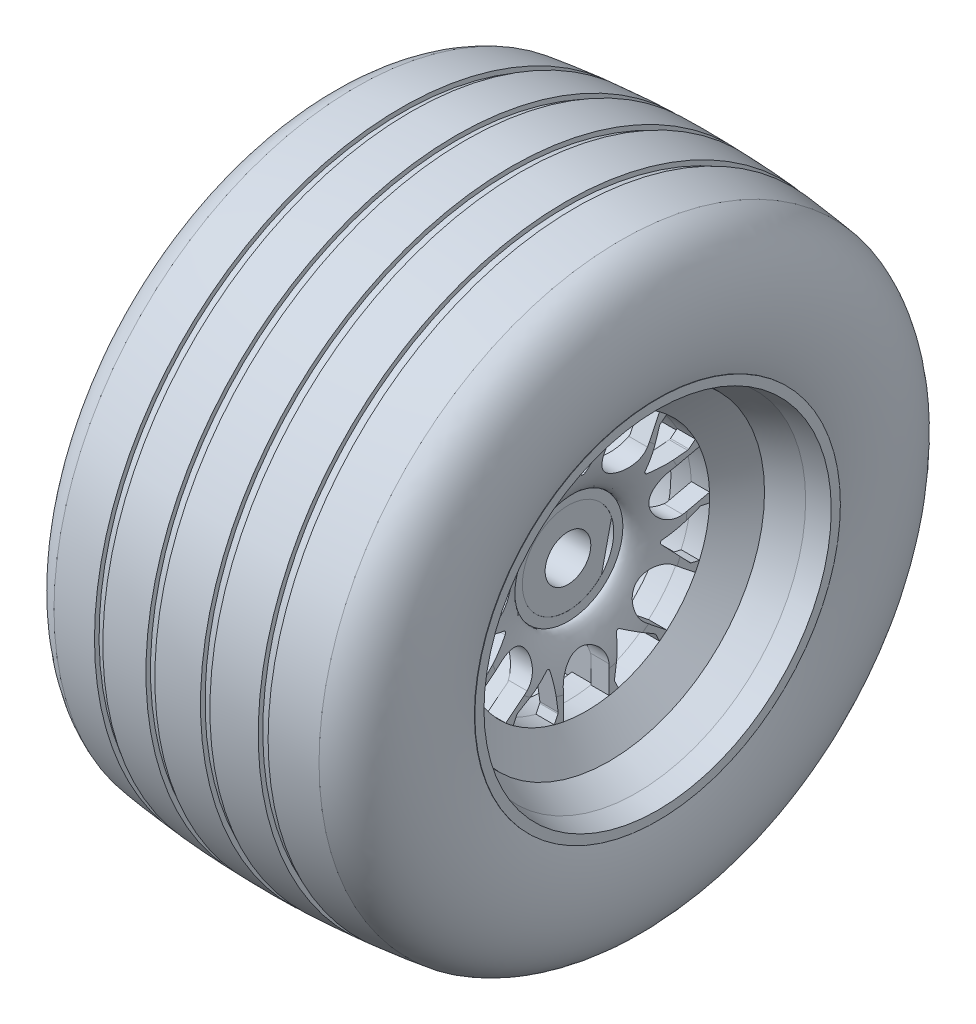
from build123d import *

# Parameters (mm, degrees)
BOSS_EXTRU_2_DEPTH      = 2.3
BOSS_EXTRU_2_DEPTH_BACK = 34.75
ESQUISSE4_R             = 20
ESQUISSE4_R_2           = 18.5
BOSS_EXTRU_3_DEPTH      = 3
BOSS_EXTRU_3_DEPTH_BACK = 31.75
ESQUISSE5_R             = 18.5
ESQUISSE5_R_2           = 17
CHANFREIN1_SIZE         = 1.5
CHANFREIN1_SIZE_2       = 3.5
ESQUISSE7_R             = 17
ESQUISSE7_R_2           = 13.5
BOSS_EXTRU_4_DEPTH      = 31.75
CHANFREIN2_SIZE         = 3.5
CHANFREIN2_SIZE_2       = 2.5
BOSS_EXTRU_5_START      = -2.5
BOSS_EXTRU_5_OUTLINE_R  = 6
BOSS_EXTRU_5_DEPTH      = 29.25
CONG_1_SIZE             = 2
CONG_1_SIZE_2           = 5
ESQUISSE10_R            = 6
ESQUISSE10_R_2          = 5
BOSS_EXTRU_6_DEPTH      = 27.25
ESQUISSE11_R            = 5
ESQUISSE11_R_2          = 2.5
BOSS_EXTRU_7_DEPTH      = 25
ENL_V_START             = -25
ESQUISSE13_R            = 16.006499161
ESQUISSE13_R_2          = 13.506499161
ENL_V_MAT_EXTRU_1_DEPTH = 25
ESQUISSE14_R            = 6
ESQUISSE14_R_2          = 4.5
BOSS_EXTRU_8_DEPTH      = 20
ESQUISSE15_R            = 4.5
ESQUISSE15_R_2          = 2.5
BOSS_EXTRU_9_DEPTH      = 20
BOSS_EXTRU_10_REACH     = 73.556
CHANFREIN3_SIZE         = 1
CHANFREIN3_SIZE2        = 4
ESQUISSE17_R            = 2.5
ENL_V_MAT_EXTRU_2_DEPTH = 4
ESQUISSE18_R            = 2.5
BOSS_EXTRU_21_DEPTH     = 3.99
ENL_V_MAT_EXTRU_3_DEPTH = 20
CHANFREIN4_SIZE2        = 0.5
CHANFREIN4_SIZE         = 2.3


with BuildPart() as part:
    # Esquisse1 → Révolution1 (revolve)
    with BuildSketch(Plane.XY, mode=Mode.PRIVATE) as r_volution1_sk:
        with BuildLine():
            Line((-18.5, 0), (18.5, 0))
            add(Edge.make_bspline(
                [(18.5, 0), (19.838405168, 4.08979284), (19.267998375, 11.346275547), (14.5, 13)],
                knots=[0, 0, 0, 0, 1, 1, 1, 1], degree=3))
            add(Edge.make_bspline(
                [(-14.5, 13), (0, 15), (14.5, 13)],
                knots=[0, 0, 0, 1, 1, 1], degree=2))
            add(Edge.make_bspline(
                [(-18.5, 0), (-19.838405168, 4.08979284), (-19.267998375, 11.346275547), (-14.5, 13)],
                knots=[0, 0, 0, 0, 1, 1, 1, 1], degree=3))
        make_face()
        with BuildLine():
            Line((-18.130534342, 0.5), (18.130534342, 0.5))
            add(Edge.make_bspline(
                [(14.381712775, 12.511569715), (14.636876339, 12.420414194), (15.139350664, 12.193822903), (16.013753743, 11.61482082), (17.295334454, 10.272133606), (18.202730118, 8.115054823), (18.598514858, 5.693803273), (18.657759464, 3.84596138), (18.52882494, 2.365757753), (18.328627834, 1.257355727), (18.203635594, 0.754257622), (18.130534342, 0.5)],
                knots=[0.028863626, 0.028863626, 0.028863626, 0.028863626, 0.089340842, 0.149818057, 0.270772488, 0.51268135, 0.633635781, 0.754590211, 0.875544642, 0.936021858, 0.996499073, 0.996499073, 0.996499073, 0.996499073], degree=3))
            add(Edge.make_bspline(
                [(-14.381712775, 12.511569715), (-4.883214165, 13.817171608), (4.883214165, 13.817171608), (14.381712775, 12.511569715)],
                knots=[0.001731057, 0.001731057, 0.001731057, 0.001731057, 0.998268943, 0.998268943, 0.998268943, 0.998268943], degree=3))
            add(Edge.make_bspline(
                [(-18.130534342, 0.5), (-18.203635594, 0.754257622), (-18.328627834, 1.257355727), (-18.52882494, 2.365757753), (-18.657759464, 3.84596138), (-18.598514858, 5.693803273), (-18.202730118, 8.115054823), (-17.295334454, 10.272133606), (-16.013753743, 11.61482082), (-15.139350664, 12.193822903), (-14.636876339, 12.420414194), (-14.381712775, 12.511569715)],
                knots=[0.028863626, 0.028863626, 0.028863626, 0.028863626, 0.089340842, 0.149818057, 0.270772488, 0.391726919, 0.51268135, 0.754590211, 0.875544642, 0.936021858, 0.996499073, 0.996499073, 0.996499073, 0.996499073], degree=3))
        make_face(mode=Mode.SUBTRACT)
        with BuildLine():
            add(Edge.make_bspline(
                [(-18.130534342, 0.5), (-18.203635594, 0.754257622), (-18.328627834, 1.257355727), (-18.52882494, 2.365757753), (-18.657759464, 3.84596138), (-18.598514858, 5.693803273), (-18.202730118, 8.115054823), (-17.295334454, 10.272133606), (-16.013753743, 11.61482082), (-15.139350664, 12.193822903), (-14.636876339, 12.420414194), (-14.381712775, 12.511569715)],
                knots=[0.028863626, 0.028863626, 0.028863626, 0.028863626, 0.089340842, 0.149818057, 0.270772488, 0.391726919, 0.51268135, 0.754590211, 0.875544642, 0.936021858, 0.996499073, 0.996499073, 0.996499073, 0.996499073], degree=3))
            add(Edge.make_bspline(
                [(-14.381712775, 12.511569715), (-4.883214165, 13.817171608), (4.883214165, 13.817171608), (14.381712775, 12.511569715)],
                knots=[0.001731057, 0.001731057, 0.001731057, 0.001731057, 0.998268943, 0.998268943, 0.998268943, 0.998268943], degree=3))
            add(Edge.make_bspline(
                [(14.381712775, 12.511569715), (14.636876339, 12.420414194), (15.139350664, 12.193822903), (16.013753743, 11.61482082), (17.295334454, 10.272133606), (18.202730118, 8.115054823), (18.598514858, 5.693803273), (18.657759464, 3.84596138), (18.52882494, 2.365757753), (18.328627834, 1.257355727), (18.203635594, 0.754257622), (18.130534342, 0.5)],
                knots=[0.028863626, 0.028863626, 0.028863626, 0.028863626, 0.089340842, 0.149818057, 0.270772488, 0.51268135, 0.633635781, 0.754590211, 0.875544642, 0.936021858, 0.996499073, 0.996499073, 0.996499073, 0.996499073], degree=3))
            Line((18.130534342, 0.5), (-18.130534342, 0.5))
        make_face()
    revolve(r_volution1_sk.sketch.rotate(Axis((-14.222170654, -20, 0), (1, 0, 0)), 90), axis=Axis((-14.222170654, -20, 0), (1, 0, 0)))

    # Esquisse2 → Enlèvement de matière-Révolution1 (revolve, cut)
    with BuildSketch(Plane.XY, mode=Mode.PRIVATE) as enl_vement_de_mati_re_r_volution1_sk:
        with BuildLine():
            add(Edge.make_bspline(
                [(9.5, 13.570749108), (9.469046555, 13.573546328), (9.354445173, 13.583852082), (9.156185559, 13.601356777), (8.905208522, 13.622916802), (8.686479763, 13.641184362), (8.551405375, 13.652205035), (8.5, 13.656361474)],
                knots=[0.173002382, 0.173002382, 0.173002382, 0.173002382, 0.176207377, 0.184868019, 0.193526873, 0.202183989, 0.207502326, 0.207502326, 0.207502326, 0.207502326], degree=3))
            Line((8.5, 13.656361474), (8.5, 13.152836254))
            add(Edge.make_bspline(
                [(9.499713629, 13.066831574), (9.166627198, 13.097058306), (8.833383724, 13.125729227), (8.5, 13.152836254)],
                knots=[0.171528386, 0.171528386, 0.171528386, 0.171528386, 0.206183616, 0.206183616, 0.206183616, 0.206183616], degree=3))
            Line((9.499713629, 13.066831574), (9.5, 13.068701961))
            Line((9.5, 13.068701961), (9.5, 13.570749108))
        make_face()
        with BuildLine():
            add(Edge.make_bspline(
                [(3.5, 13.941736029), (3.470411898, 13.942721126), (3.35866268, 13.946394493), (3.163071873, 13.952511989), (2.913223052, 13.959734696), (2.69164005, 13.965610118), (2.55389754, 13.968991735), (2.5, 13.970273484)],
                knots=[0.379668525, 0.379668525, 0.379668525, 0.379668525, 0.382721406, 0.391198576, 0.399848132, 0.408497116, 0.414056722, 0.414056722, 0.414056722, 0.414056722], degree=3))
            Line((2.5, 13.970273484), (2.5, 13.469815753))
            add(Edge.make_bspline(
                [(3.499393313, 13.440849741), (3.166312677, 13.452099691), (2.833176039, 13.461757692), (2.5, 13.469815753)],
                knots=[0.379163728, 0.379163728, 0.379163728, 0.379163728, 0.413685793, 0.413685793, 0.413685793, 0.413685793], degree=3))
            Line((3.499393313, 13.440849741), (3.5, 13.441457665))
            Line((3.5, 13.441457665), (3.5, 13.941736029))
        make_face()
        with BuildLine():
            add(Edge.make_bspline(
                [(-2.5, 13.970273484), (-2.581304098, 13.968339974), (-2.74626995, 13.964225502), (-2.993396157, 13.957480158), (-3.241385209, 13.950124496), (-3.40975236, 13.944735733), (-3.495956983, 13.941870636), (-3.5, 13.941736029)],
                knots=[0.585943286, 0.585943286, 0.585943286, 0.585943286, 0.594329916, 0.60296021, 0.611436962, 0.619914327, 0.620331483, 0.620331483, 0.620331483, 0.620331483], degree=3))
            Line((-3.5, 13.941736029), (-3.5, 13.441457665))
            add(Edge.make_bspline(
                [(-2.5, 13.470131442), (-2.583343957, 13.468139952), (-2.750025673, 13.463958856), (-3.000036551, 13.457087793), (-3.250029044, 13.449620765), (-3.416678536, 13.444244994), (-3.5, 13.441457665)],
                knots=[0.586353967, 0.586353967, 0.586353967, 0.586353967, 0.594992084, 0.603630201, 0.612268318, 0.620906435, 0.620906435, 0.620906435, 0.620906435], degree=3))
            Line((-2.5, 13.470131442), (-2.5, 13.970273484))
        make_face()
        with BuildLine():
            add(Edge.make_bspline(
                [(-8.5, 13.656361474), (-8.536308973, 13.653425672), (-8.664856178, 13.642965242), (-8.877243674, 13.625292802), (-9.137151077, 13.603013358), (-9.341939611, 13.584968758), (-9.462885168, 13.574103124), (-9.5, 13.570749108)],
                knots=[0.79249768, 0.79249768, 0.79249768, 0.79249768, 0.796254161, 0.805797567, 0.81447522, 0.823154663, 0.826997623, 0.826997623, 0.826997623, 0.826997623], degree=3))
            Line((-9.5, 13.570749108), (-9.5, 13.068701961))
            add(Edge.make_bspline(
                [(-8.5, 13.154721949), (-8.583366254, 13.14794917), (-8.750082899, 13.134205585), (-9.000108949, 13.112996811), (-9.250087352, 13.091192573), (-9.416700791, 13.076265421), (-9.5, 13.068701961)],
                knots=[0.793893955, 0.793893955, 0.793893955, 0.793893955, 0.802560004, 0.811226054, 0.819892104, 0.828558153, 0.828558153, 0.828558153, 0.828558153], degree=3))
            Line((-8.5, 13.154721949), (-8.5, 13.656361474))
        make_face()
    revolve(enl_vement_de_mati_re_r_volution1_sk.sketch.rotate(Axis((-16.70272556, -20, 0), (1, 0, 0)), 180), axis=Axis((-16.70272556, -20, 0), (1, 0, 0)), mode=Mode.SUBTRACT)

    # Esquisse4 → Boss.-Extru.2 (add, two sides: drawn at the far end of the back side and taken through both)
    with BuildSketch(Plane(origin=(16.25, 0, 0), x_dir=(0, 0, -1), z_dir=(1, 0, 0)).offset(-BOSS_EXTRU_2_DEPTH_BACK)):
        with Locations(Location((0, -20, 0), (0, 0, 180))):
            Circle(ESQUISSE4_R)
        with Locations((0, -20)):
            Circle(ESQUISSE4_R_2, mode=Mode.SUBTRACT)
    extrude(amount=BOSS_EXTRU_2_DEPTH + BOSS_EXTRU_2_DEPTH_BACK)



with BuildPart() as body_2:
    # Esquisse5 → Boss.-Extru.3 (new, two sides: drawn at the far end of the back side and taken through both)
    with BuildSketch(Plane(origin=(13.25, 0, 0), x_dir=(0, 0, -1), z_dir=(1, 0, 0)).offset(-BOSS_EXTRU_3_DEPTH_BACK)):
        with Locations((0, -20)):
            Circle(ESQUISSE5_R)
        with Locations((0, -20)):
            Circle(ESQUISSE5_R_2, mode=Mode.SUBTRACT)
    extrude(amount=BOSS_EXTRU_3_DEPTH + BOSS_EXTRU_3_DEPTH_BACK)

    # Chanfrein1
    # the kernel refuses this chamfer: 3.5, 1.5 mm, written as the material it takes off along each edge
    with BuildSketch(Plane(origin=(16.25, -20, 0), x_dir=(0, 0, -1), z_dir=(0, -1, 0))) as chanfrein1_piece_1:
        Polygon((17 + CHANFREIN1_SIZE, 0), (17, -CHANFREIN1_SIZE_2), (17, 0), align=None)
    revolve(axis=Axis((16.25, -20, 0), (1, 0, 0)), mode=Mode.SUBTRACT)


with BuildPart() as part_1:
    add(part.part)

    add(body_2.part)  # Boss.-Extru.4 merges body 2
    # Esquisse7 → Boss.-Extru.4 (add)
    with BuildSketch(Plane(origin=(13.25, 0, 0), x_dir=(0, 0, -1), z_dir=(1, 0, 0))):
        with Locations((0, -20)):
            Circle(ESQUISSE7_R)
        with Locations((0, -20)):
            Circle(ESQUISSE7_R_2, mode=Mode.SUBTRACT)
    extrude(amount=-BOSS_EXTRU_4_DEPTH)

    # Chanfrein2
    # the kernel refuses this chamfer: 3.5, 2.5 mm, written as the material it takes off along each edge
    with BuildSketch(Plane(origin=(13.25, -20, 0), x_dir=(0, 0, -1), z_dir=(0, -1, 0))) as chanfrein2_piece_1:
        Polygon((13.5 + CHANFREIN2_SIZE, 0), (13.5, -CHANFREIN2_SIZE_2), (13.5, 0), align=None)
    revolve(axis=Axis((13.25, -20, 0), (1, 0, 0)), mode=Mode.SUBTRACT)



with BuildPart() as body_2_2:
    # Boss.-Extru.5: read off the stored shape, not the designer's step
    # Boss.-Extru.5 outline → Boss.-Extru.5 (new body)
    with BuildSketch(Plane.ZY.offset(-8.25).offset(BOSS_EXTRU_5_START)):
        with BuildLine():
            Line((-3.503696091, -6.962587922), (-2.202044874, -9.665494525))
            ThreePointArc((-2.202044874, -9.665494525), (-3.369757696, -13.002626043), (-6.706889214, -11.834913221))
            Line((-6.706889214, -11.834913221), (-8.008540431, -9.132006617))
            ThreePointArc((-8.008540431, -9.132006617), (-8.417112325, -9.445274987), (-8.813442202, -9.77389436))
            Line((-8.813442202, -9.77389436), (-8.090574677, -10.350361975))
            ThreePointArc((-8.090574677, -10.350361975), (-8.040766001, -10.403709768), (-8.008487581, -10.46916964))
            Line((-8.008487581, -10.46916964), (-6.761048774, -14.34182691))
            ThreePointArc((-6.761048774, -14.34182691), (-6.803550451, -14.574349566), (-7.020785765, -14.667526795))
            Line((-7.020785765, -14.667526795), (-11.07392868, -14.313111196))
            ThreePointArc((-11.07392868, -14.313111196), (-11.144929961, -14.296208255), (-11.208023687, -14.259519387))
            Line((-11.208023687, -14.259519387), (-11.930891211, -13.683051773))
            ThreePointArc((-11.930891211, -13.683051773), (-12.163079717, -14.142569522), (-12.377577995, -14.610606436))
            Line((-12.377577995, -14.610606436), (-9.452794258, -15.278169238))
            ThreePointArc((-9.452794258, -15.278169238), (-7.571776812, -18.271791354), (-10.565398928, -20.152808799))
            Line((-10.565398928, -20.152808799), (-13.490182664, -19.485245997))
            ThreePointArc((-13.490182664, -19.485245997), (-13.5, -20), (-13.490182664, -20.514754003))
            Line((-13.490182664, -20.514754003), (-12.588781605, -20.309015094))
            ThreePointArc((-12.588781605, -20.309015094), (-12.516017419, -20.303334907), (-12.444713564, -20.318912185))
            Line((-12.444713564, -20.318912185), (-8.639182815, -21.758187567))
            ThreePointArc((-8.639182815, -21.758187567), (-8.483888645, -21.936392221), (-8.546483757, -22.164328681))
            Line((-8.546483757, -22.164328681), (-11.350670302, -25.112228903))
            ThreePointArc((-11.350670302, -25.112228903), (-11.408154128, -25.157201128), (-11.476176935, -25.183654655))
            Line((-11.476176935, -25.183654655), (-12.377577995, -25.389393564))
            ThreePointArc((-12.377577995, -25.389393564), (-12.163079717, -25.857430478), (-11.930891211, -26.316948227))
            Line((-11.930891211, -26.316948227), (-9.585396764, -24.446478822))
            ThreePointArc((-9.585396764, -24.446478822), (-6.072093553, -24.842333023), (-6.467947754, -28.355636234))
            Line((-6.467947754, -28.355636234), (-8.813442202, -30.22610564))
            ThreePointArc((-8.813442202, -30.22610564), (-8.417112325, -30.554725013), (-8.008540431, -30.867993383))
            Line((-8.008540431, -30.867993383), (-7.60737922, -30.034973544))
            ThreePointArc((-7.60737922, -30.034973544), (-7.56645244, -29.974542675), (-7.509816408, -29.92850735))
            Line((-7.509816408, -29.92850735), (-4.011835989, -27.850597126))
            ThreePointArc((-4.011835989, -27.850597126), (-3.77568565, -27.840292038), (-3.636505163, -28.031346925))
            Line((-3.636505163, -28.031346925), (-3.080125676, -32.061733975))
            ThreePointArc((-3.080125676, -32.061733975), (-3.080805554, -32.134716364), (-3.10253488, -32.20439224))
            Line((-3.10253488, -32.20439224), (-3.503696091, -33.037412078))
            ThreePointArc((-3.503696091, -33.037412078), (-3.004032608, -33.161526814), (-2.5, -33.266499161))
            Line((-2.5, -33.266499161), (-2.5, -30.266499161))
            ThreePointArc((-2.5, -30.266499161), (0, -27.766499161), (2.5, -30.266499161))
            Line((2.5, -30.266499161), (2.5, -33.266499161))
            ThreePointArc((2.5, -33.266499161), (3.004032608, -33.161526814), (3.503696091, -33.037412078))
            Line((3.503696091, -33.037412078), (3.10253488, -32.20439224))
            ThreePointArc((3.10253488, -32.20439224), (3.080805554, -32.134716364), (3.080125676, -32.061733975))
            Line((3.080125676, -32.061733975), (3.636505163, -28.031346925))
            ThreePointArc((3.636505163, -28.031346925), (3.77568565, -27.840292038), (4.011835989, -27.850597126))
            Line((4.011835989, -27.850597126), (7.509816408, -29.92850735))
            ThreePointArc((7.509816408, -29.92850735), (7.56645244, -29.974542675), (7.60737922, -30.034973544))
            Line((7.60737922, -30.034973544), (8.008540431, -30.867993383))
            ThreePointArc((8.008540431, -30.867993383), (8.417112325, -30.554725013), (8.813442202, -30.22610564))
            Line((8.813442202, -30.22610564), (6.467947754, -28.355636234))
            ThreePointArc((6.467947754, -28.355636234), (6.072093553, -24.842333023), (9.585396764, -24.446478822))
            Line((9.585396764, -24.446478822), (11.930891211, -26.316948227))
            ThreePointArc((11.930891211, -26.316948227), (12.163079717, -25.857430478), (12.377577995, -25.389393564))
            Line((12.377577995, -25.389393564), (11.476176935, -25.183654655))
            ThreePointArc((11.476176935, -25.183654655), (11.408154128, -25.157201128), (11.350670302, -25.112228903))
            Line((11.350670302, -25.112228903), (8.546483757, -22.164328681))
            ThreePointArc((8.546483757, -22.164328681), (8.483888645, -21.936392221), (8.639182815, -21.758187567))
            Line((8.639182815, -21.758187567), (12.444713564, -20.318912185))
            ThreePointArc((12.444713564, -20.318912185), (12.516017419, -20.303334907), (12.588781605, -20.309015094))
            Line((12.588781605, -20.309015094), (13.490182664, -20.514754003))
            ThreePointArc((13.490182664, -20.514754003), (13.5, -20), (13.490182664, -19.485245997))
            Line((13.490182664, -19.485245997), (10.565398928, -20.152808799))
            ThreePointArc((10.565398928, -20.152808799), (7.571776812, -18.271791354), (9.452794258, -15.278169238))
            Line((9.452794258, -15.278169238), (12.377577995, -14.610606436))
            ThreePointArc((12.377577995, -14.610606436), (12.163079717, -14.142569522), (11.930891211, -13.683051773))
            Line((11.930891211, -13.683051773), (11.208023687, -14.259519387))
            ThreePointArc((11.208023687, -14.259519387), (11.144929961, -14.296208255), (11.07392868, -14.313111196))
            Line((11.07392868, -14.313111196), (7.020785765, -14.667526795))
            ThreePointArc((7.020785765, -14.667526795), (6.803550451, -14.574349566), (6.761048774, -14.34182691))
            Line((6.761048774, -14.34182691), (8.008487581, -10.46916964))
            ThreePointArc((8.008487581, -10.46916964), (8.040766001, -10.403709768), (8.090574677, -10.350361975))
            Line((8.090574677, -10.350361975), (8.813442202, -9.77389436))
            ThreePointArc((8.813442202, -9.77389436), (8.417112325, -9.445274987), (8.008540431, -9.132006617))
            Line((8.008540431, -9.132006617), (6.706889214, -11.834913221))
            ThreePointArc((6.706889214, -11.834913221), (3.369757696, -13.002626043), (2.202044874, -9.665494525))
            Line((2.202044874, -9.665494525), (3.503696091, -6.962587922))
            ThreePointArc((3.503696091, -6.962587922), (3.004032608, -6.838473186), (2.5, -6.733500839))
            Line((2.5, -6.733500839), (2.5, -7.658083106))
            ThreePointArc((2.5, -7.658083106), (2.489346217, -7.730286902), (2.458292894, -7.79633675))
            Line((2.458292894, -7.79633675), (0.208292894, -11.186185995))
            ThreePointArc((0.208292894, -11.186185995), (0, -11.297932351), (-0.208292894, -11.186185995))
            Line((-0.208292894, -11.186185995), (-2.458292894, -7.79633675))
            ThreePointArc((-2.458292894, -7.79633675), (-2.489346217, -7.730286902), (-2.5, -7.658083106))
            Line((-2.5, -7.658083106), (-2.5, -6.733500839))
            ThreePointArc((-2.5, -6.733500839), (-3.004032608, -6.838473186), (-3.503696091, -6.962587922))
        make_face()
        with Locations((0, -20)):
            Circle(BOSS_EXTRU_5_OUTLINE_R, mode=Mode.SUBTRACT)
    extrude(amount=BOSS_EXTRU_5_DEPTH)

    # Congé1
    # a fillet whose section is not a circle: 5, 2 mm, written as the material it takes off along each edge
    with BuildSketch(Plane(origin=(10.75, -20, 0), x_dir=(0, 0, 1), z_dir=(0, -1, 0))) as cong_1_piece_1:
        with BuildLine():
            Bezier((6, CONG_1_SIZE), (6, 0), (6 + CONG_1_SIZE_2, 0), weights=[1, 0.428571429, 1])
            Line((6 + CONG_1_SIZE_2, 0), (6, 0))
            Line((6, 0), (6, CONG_1_SIZE))
        make_face()
    revolve(axis=Axis((10.75, -20, 0), (-1, 0, 0)), mode=Mode.SUBTRACT)


with BuildPart() as part_2:
    add(part_1.part)

    add(body_2_2.part)  # Boss.-Extru.6 merges body 2 2
    # Esquisse10 → Boss.-Extru.6 (add)
    with BuildSketch(Plane(origin=(8.75, 0, 0), x_dir=(0, 0, -1), z_dir=(1, 0, 0))):
        with Locations((0, -20)):
            Circle(ESQUISSE10_R)
        with Locations((0, -20)):
            Circle(ESQUISSE10_R_2, mode=Mode.SUBTRACT)
    extrude(amount=-BOSS_EXTRU_6_DEPTH)

    # Esquisse11 → Boss.-Extru.7 (add)
    with BuildSketch(Plane(origin=(8.75, 0, 0), x_dir=(0, 0, -1), z_dir=(1, 0, 0))):
        with Locations((0, -20)):
            Circle(ESQUISSE11_R)
        with Locations((0, -20)):
            Circle(ESQUISSE11_R_2, mode=Mode.SUBTRACT)
    extrude(amount=-BOSS_EXTRU_7_DEPTH)

    # Esquisse12 → Enlèvement de matière-Révolution5 (revolve, cut)
    with BuildSketch(Plane.XY, mode=Mode.PRIVATE) as enl_vement_de_mati_re_r_volution5_sk:
        Polygon((6.75, -20), (-18.5, -20), (-18.5, -30.266499161), (-18.5, -33.266499161), (-18.5, -33.506499161), (8.75, -33.506499161), (8.75, -33.266499161), (8.75, -30.711483848), (6.75, -26), align=None)
    revolve(enl_vement_de_mati_re_r_volution5_sk.sketch.rotate(Axis((16.70272556, -20, 0), (-1, 0, 0)), 270), axis=Axis((16.70272556, -20, 0), (-1, 0, 0)), mode=Mode.SUBTRACT)

    # Esquisse13 → Enlèv. mat.-Extru.1 (cut)
    with BuildSketch(Plane.ZY.offset(18.5).offset(ENL_V_START)):
        with Locations((0, -20)):
            Circle(ESQUISSE13_R)
        with Locations(Location((0, -20, 0), (0, 0, 180))):
            Circle(ESQUISSE13_R_2, mode=Mode.SUBTRACT)
    extrude(amount=ENL_V_MAT_EXTRU_1_DEPTH, mode=Mode.SUBTRACT)

    # Esquisse14 → Boss.-Extru.8 (add)
    with BuildSketch(Plane.ZY.offset(-6.75)):
        with Locations((0, -20)):
            Circle(ESQUISSE14_R)
        with Locations((0, -20)):
            Circle(ESQUISSE14_R_2, mode=Mode.SUBTRACT)
    extrude(amount=BOSS_EXTRU_8_DEPTH)

    # Esquisse15 → Boss.-Extru.9 (add)
    with BuildSketch(Plane.ZY.offset(-6.75)):
        with Locations((0, -20)):
            Circle(ESQUISSE15_R)
        with Locations(Location((0, -20, 0), (0, 0, 180))):
            Circle(ESQUISSE15_R_2, mode=Mode.SUBTRACT)
    extrude(amount=BOSS_EXTRU_9_DEPTH)

    # Boss.-Extru.10: up to this face of the body (flat: up to its plane)
    boss_extru_10_end = Plane(part_2.part.faces().sort_by_distance((8.75, -20, 13.124477676))[0])
    # Esquisse16 → Boss.-Extru.10 (add, up to the picked face)
    with BuildSketch(Plane.ZY.offset(13.25), mode=Mode.PRIVATE) as boss_extru_10_sk1:
        with BuildLine():
            Line((-6.046832295, -21.190771897), (-5.901668122, -21.081810232))
            ThreePointArc((-5.901668122, -21.081810232), (-5.858113734, -21.297113517), (-5.806707442, -21.51067822))
            Line((-5.806707442, -21.51067822), (-12.431086361, -26.483002614))
            ThreePointArc((-12.431086361, -26.483002614), (-14.134521849, -27.511544947), (-12.671211214, -26.163096291))
            Line((-12.671211214, -26.163096291), (-6.046832295, -21.190771897))
        make_face()
    boss_extru_10_tool1 = split(extrude(boss_extru_10_sk1.sketch, amount=-BOSS_EXTRU_10_REACH, mode=Mode.PRIVATE), bisect_by=boss_extru_10_end, keep=Keep.BOTH, mode=Mode.PRIVATE)
    # Esquisse16 → Boss.-Extru.10 (add, up to the picked face)
    with BuildSketch(Plane.ZY.offset(13.25), mode=Mode.PRIVATE) as boss_extru_10_sk2:
        with BuildLine():
            Line((-12.819271116, -14.323071336), (-4.801518664, -16.402025776))
            ThreePointArc((-4.801518664, -16.402025776), (-4.666598355, -16.228679304), (-4.525423185, -16.06038771))
            Line((-4.525423185, -16.06038771), (-4.701121227, -16.014830277))
            Line((-4.701121227, -16.014830277), (-12.718873679, -13.935875837))
            ThreePointArc((-12.718873679, -13.935875837), (-14.685492549, -13.632557499), (-12.819271116, -14.323071336))
        make_face()
    boss_extru_10_tool2 = split(extrude(boss_extru_10_sk2.sketch, amount=-BOSS_EXTRU_10_REACH, mode=Mode.PRIVATE), bisect_by=boss_extru_10_end, keep=Keep.BOTH, mode=Mode.PRIVATE)
    # Esquisse16 → Boss.-Extru.10 (add, up to the picked face)
    with BuildSketch(Plane.ZY.offset(13.25), mode=Mode.PRIVATE) as boss_extru_10_sk3:
        with BuildLine():
            Line((-3.554283256, -6.437983131), (-0.180688399, -14.002721309))
            ThreePointArc((-0.180688399, -14.002721309), (0.038960767, -14.000126496), (0.258557712, -14.005573596))
            Line((0.258557712, -14.005573596), (0.18463001, -13.839802741))
            Line((0.18463001, -13.839802741), (-3.188964846, -6.275064564))
            ThreePointArc((-3.188964846, -6.275064564), (-4.177987829, -4.548384127), (-3.554283256, -6.437983131))
        make_face()
    boss_extru_10_tool3 = split(extrude(boss_extru_10_sk3.sketch, amount=-BOSS_EXTRU_10_REACH, mode=Mode.PRIVATE), bisect_by=boss_extru_10_end, keep=Keep.BOTH, mode=Mode.PRIVATE)
    # Esquisse16 → Boss.-Extru.10 (add, up to the picked face)
    with BuildSketch(Plane.ZY.offset(13.25), mode=Mode.PRIVATE) as boss_extru_10_sk4:
        with BuildLine():
            Line((8.387152391, -8.765370243), (4.576203916, -16.119490018))
            ThreePointArc((4.576203916, -16.119490018), (4.715181637, -16.289600812), (4.847839378, -16.464684828))
            Line((4.847839378, -16.464684828), (4.931351084, -16.303529386))
            Line((4.931351084, -16.303529386), (8.742299559, -8.949409611))
            ThreePointArc((8.742299559, -8.949409611), (9.475626941, -7.099592662), (8.387152391, -8.765370243))
        make_face()
    boss_extru_10_tool4 = split(extrude(boss_extru_10_sk4.sketch, amount=-BOSS_EXTRU_10_REACH, mode=Mode.PRIVATE), bisect_by=boss_extru_10_end, keep=Keep.BOTH, mode=Mode.PRIVATE)
    # Esquisse16 → Boss.-Extru.10 (add, up to the picked face)
    with BuildSketch(Plane.ZY.offset(13.25), mode=Mode.PRIVATE) as boss_extru_10_sk5:
        with BuildLine():
            Line((14.01289122, -19.552662706), (5.887121345, -21.158361892))
            ThreePointArc((5.887121345, -21.158361892), (5.840774562, -21.373081394), (5.786599115, -21.585960492))
            Line((5.786599115, -21.585960492), (5.96466421, -21.550773798))
            Line((5.96466421, -21.550773798), (14.090434086, -19.945074612))
            ThreePointArc((14.090434086, -19.945074612), (15.993901357, -19.365071044), (14.01289122, -19.552662706))
        make_face()
    boss_extru_10_tool5 = split(extrude(boss_extru_10_sk5.sketch, amount=-BOSS_EXTRU_10_REACH, mode=Mode.PRIVATE), bisect_by=boss_extru_10_end, keep=Keep.BOTH, mode=Mode.PRIVATE)
    # Esquisse16 → Boss.-Extru.10 (add, up to the picked face)
    with BuildSketch(Plane.ZY.offset(13.25), mode=Mode.PRIVATE) as boss_extru_10_sk6:
        with BuildLine():
            Line((9.08663715, -30.676809276), (2.764916326, -25.324963635))
            ThreePointArc((2.764916326, -25.324963635), (2.568145112, -25.422603681), (2.367931693, -25.512975557))
            Line((2.367931693, -25.512975557), (2.506463529, -25.63025391))
            Line((2.506463529, -25.63025391), (8.828184353, -30.982099551))
            ThreePointArc((8.828184353, -30.982099551), (10.468441835, -32.108663879), (9.08663715, -30.676809276))
        make_face()
    boss_extru_10_tool6 = split(extrude(boss_extru_10_sk6.sketch, amount=-BOSS_EXTRU_10_REACH, mode=Mode.PRIVATE), bisect_by=boss_extru_10_end, keep=Keep.BOTH, mode=Mode.PRIVATE)
    # Esquisse16 → Boss.-Extru.10 (add, up to the picked face)
    with BuildSketch(Plane.ZY.offset(13.25), mode=Mode.PRIVATE) as boss_extru_10_sk7:
        with BuildLine():
            Line((-2.682040028, -33.761100693), (-2.439327081, -25.481759151))
            ThreePointArc((-2.439327081, -25.481759151), (-2.638349988, -25.388794795), (-2.833836591, -25.288607584))
            Line((-2.833836591, -25.288607584), (-2.839155312, -25.470037991))
            Line((-2.839155312, -25.470037991), (-3.081868259, -33.749379533))
            ThreePointArc((-3.081868259, -33.749379533), (-2.939967906, -35.734185842), (-2.682040028, -33.761100693))
        make_face()
    boss_extru_10_tool7 = split(extrude(boss_extru_10_sk7.sketch, amount=-BOSS_EXTRU_10_REACH, mode=Mode.PRIVATE), bisect_by=boss_extru_10_end, keep=Keep.BOTH, mode=Mode.PRIVATE)
    add(boss_extru_10_tool1.solids().sort_by(Axis((-13.25, -25.310318, -11.202559), (1, 0, 0)))[0])
    add(boss_extru_10_tool2.solids().sort_by(Axis((-13.25, -14.552416, -11.136456), (1, 0, 0)))[0])
    add(boss_extru_10_tool3.solids().sort_by(Axis((-13.25, -7.896655, -2.684374), (1, 0, 0)))[0])
    add(boss_extru_10_tool4.solids().sort_by(Axis((-13.25, -10.35496, 7.789096), (1, 0, 0)))[0])
    add(boss_extru_10_tool5.solids().sort_by(Axis((-13.25, -20.076177, 12.397218), (1, 0, 0)))[0])
    add(boss_extru_10_tool6.solids().sort_by(Axis((-13.25, -29.740031, 7.669982), (1, 0, 0)))[0])
    add(boss_extru_10_tool7.solids().sort_by(Axis((-13.25, -32.069443, -2.832907), (1, 0, 0)))[0])

    # Chanfrein3
    chanfrein3_edges = [part_2.edges().sort_by_distance(p)[0] for p in [
        (-18.5, -20, -16.006499161),
    ]]
    chanfrein3_side = [part_2.faces().sort_by_distance(p)[0] for p in [
        (-18.5, -20, -19.434314575),
    ]]
    chamfer(chanfrein3_edges, length=CHANFREIN3_SIZE, length2=CHANFREIN3_SIZE2, reference=chanfrein3_side[0])

    # Esquisse17 → Enlèv. mat.-Extru.2 (cut)
    with BuildSketch(Plane(origin=(8.75, 0, 0), x_dir=(0, 0, -1), z_dir=(1, 0, 0))):
        with BuildLine():
            add(Edge.make_bspline(
                [(-1.913417162, -15.380602337), (-2.218607286, -15.507016226), (-2.506291853, -15.661264683), (-2.912635095, -15.932680359), (-3.043841723, -16.029895807), (-3.297629836, -16.238041044), (-3.420505265, -16.349383949), (-3.768038921, -16.697078685), (-3.97459112, -16.948871442), (-4.337874411, -17.492089366), (-4.494804762, -17.785698313), (-4.744396293, -18.388447027), (-4.839282944, -18.700222066), (-4.967812154, -19.345069341), (-4.999938563, -19.673410349), (-5.000061261, -20.324714051), (-4.96814593, -20.652524985), (-4.839791989, -21.297950289), (-4.744975304, -21.609822188), (-4.49570232, -22.212464669), (-4.338968927, -22.506040259), (-3.975715958, -23.049678891), (-3.769247354, -23.301512799), (-3.306369155, -23.765003239), (-3.049652335, -23.975667143), (-2.507888041, -24.337800661), (-2.220344357, -24.492054827), (-1.61072104, -24.744986159), (-1.297582536, -24.839757668), (-0.818449661, -24.935202431), (-0.65700824, -24.959223111), (-0.33063528, -24.991544504), (-0.16501093, -24.999779801), (0.326907058, -25.000066554), (0.651028465, -24.968244064), (1.291679525, -24.841041305), (1.61035289, -24.744614132), (2.213439586, -24.49537232), (2.500933425, -24.342113636), (3.04741605, -23.977493068), (3.302841651, -23.767890087), (3.763720246, -23.307679978), (3.972690603, -23.053892724), (4.338884614, -22.50647782), (4.492517012, -22.218898064), (4.742595665, -21.616814606), (4.839480437, -21.298619904), (4.967414792, -20.657091259), (4.999618563, -20.333058246), (5.000374789, -19.678442023), (4.967963837, -19.347673748), (4.841261018, -18.70833356), (4.747198516, -18.396009037), (4.495489565, -17.786568188), (4.340864963, -17.497412227), (4.069878454, -17.090943036), (3.97285641, -16.959763468), (3.765248579, -16.70613885), (3.654037764, -16.583140422), (3.306200449, -16.234797275), (3.05450057, -16.02802606), (2.512118952, -15.664582867), (2.218594996, -15.50729718), (1.615643715, -15.256977984), (1.304067301, -15.161908152), (0.821301096, -15.06518406), (0.657309598, -15.040709639), (0.331203982, -15.008315379), (0.168259413, -15.000180196), (-0.320253772, -14.99964846), (-0.646572838, -15.031020316), (-1.293818597, -15.159041833), (-1.608227038, -15.254188449), (-1.913417162, -15.380602337)],
                knots=[0, 0, 0, 0, 0.03125, 0.03125, 0.046875, 0.046875, 0.0625, 0.0625, 0.09375, 0.09375, 0.125, 0.125, 0.15625, 0.15625, 0.1875, 0.1875, 0.21875, 0.21875, 0.25, 0.25, 0.28125, 0.28125, 0.3125, 0.3125, 0.34375, 0.34375, 0.375, 0.375, 0.40625, 0.40625, 0.421875, 0.421875, 0.4375, 0.4375, 0.46875, 0.46875, 0.5, 0.5, 0.53125, 0.53125, 0.5625, 0.5625, 0.59375, 0.59375, 0.625, 0.625, 0.65625, 0.65625, 0.6875, 0.6875, 0.71875, 0.71875, 0.75, 0.75, 0.78125, 0.78125, 0.796875, 0.796875, 0.8125, 0.8125, 0.84375, 0.84375, 0.875, 0.875, 0.90625, 0.90625, 0.921875, 0.921875, 0.9375, 0.9375, 0.96875, 0.96875, 1, 1, 1, 1], degree=3))
        make_face()
        with Locations((0, -20)):
            Circle(ESQUISSE17_R, mode=Mode.SUBTRACT)
    extrude(amount=-ENL_V_MAT_EXTRU_2_DEPTH, mode=Mode.SUBTRACT)

    # Esquisse19 → Enlèvement de matière-Révolution6 (revolve, cut)
    with BuildSketch(Plane.XY, mode=Mode.PRIVATE) as enl_vement_de_mati_re_r_volution6_sk:
        Polygon((-14.5, -3.993500839), (-14.5, -14.002721309), (-10.5, -14.002721309), (-10.5, -8.46168015), (-13.25, -5.97168015), (-13.25, -4.548384127), (-13.25, -3.993500839), align=None)
    revolve(enl_vement_de_mati_re_r_volution6_sk.sketch.rotate(Axis((19.127436287, -20, 0), (-1, 0, 0)), 90), axis=Axis((19.127436287, -20, 0), (-1, 0, 0)), mode=Mode.SUBTRACT)

    # Esquisse20 → Enlèv. mat.-Extru.3 (cut)
    with BuildSketch(Plane.ZY.offset(13.25)):
        Polygon((-2.946722558, -17.234107829), (-3.868694163, -21.168990508), (-0.921971605, -23.934882678), (2.946722558, -22.765892171), (3.868694163, -18.831009492), (0.921971605, -16.065117322), align=None)
    extrude(amount=-ENL_V_MAT_EXTRU_3_DEPTH, mode=Mode.SUBTRACT)

    # Chanfrein4
    chanfrein4_edges = [part_2.edges().sort_by_distance(p)[0] for p in [
        (18.55, -20, 18.5),
    ]]
    chanfrein4_side = [part_2.faces().sort_by_distance(p)[0] for p in [
        (18.54, -20, 18.5),
    ]]
    chamfer(chanfrein4_edges, length=CHANFREIN4_SIZE - 0.0001, length2=CHANFREIN4_SIZE2 - 0.0001, reference=chanfrein4_side[0])  # a hair under: the kernel refuses the full size


with BuildPart() as body_2_3:
    # Esquisse18 → Boss.-Extru.21 (new body)
    with BuildSketch(Plane(origin=(4.75, 0, 0), x_dir=(0, 0, -1), z_dir=(1, 0, 0))):
        with BuildLine():
            Line((4.770276223, -18.501943774), (3.682470028, -23.382177138))
            ThreePointArc((3.682470028, -23.382177138), (-4.880204833, -18.912200164), (4.770276223, -18.501943774))
        make_face()
        with Locations(Location((0, -20, 0), (0, 0, 90))):
            Circle(ESQUISSE18_R, mode=Mode.SUBTRACT)
    extrude(amount=BOSS_EXTRU_21_DEPTH)


solid = Compound([part_2.part, body_2_3.part])
